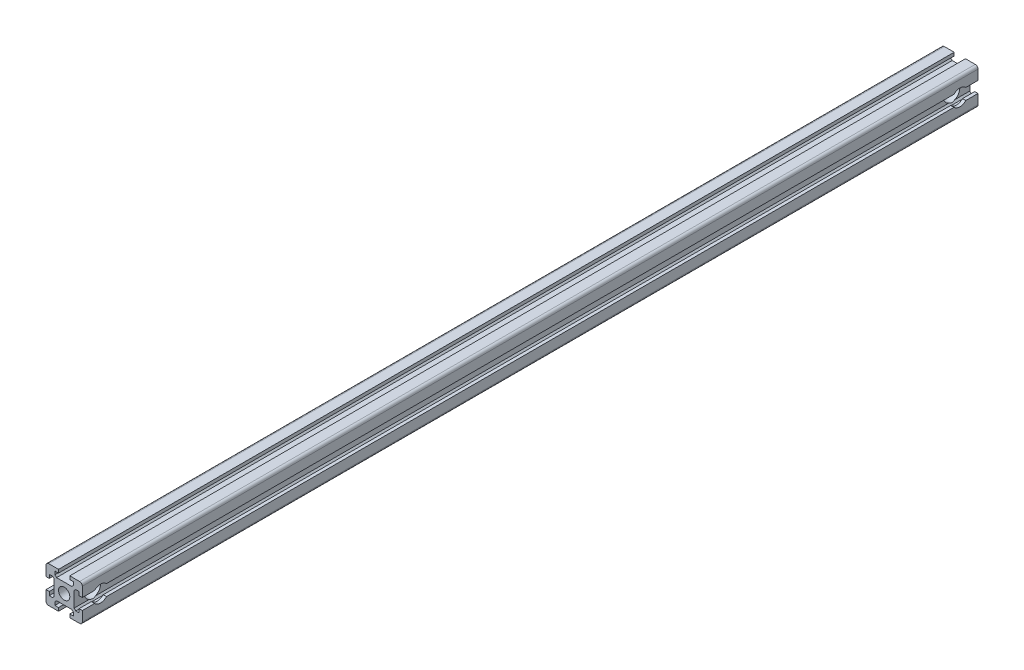
from build123d import *

# Parameters (mm, degrees)
SKETCH1_R               = 3.1
BOSS_EXTRUDE1_DEPTH     = 493
CUT_EXTRUDE2_DEPTH      = 494.34473719
CUT_EXTRUDE2_DEPTH_BACK = 11
SKETCH3_R               = 4.5


with BuildPart() as part:
    # Sketch1 → Boss-Extrude1 (new body)
    with BuildSketch(Plane.XY):
        with BuildLine():
            Line((-10, 3.1), (-8.2, 3.1))
            Line((-8.2, 3.1), (-8.2, 5.1))
            Line((-8.2, 5.1), (-6.4, 5.1))
            Line((-6.4, 5.1), (-5.492892349, 4.192892349))
            Line((-5.492892349, 4.192892349), (-5.492892349, -4.192892349))
            Line((-5.492892349, -4.192892349), (-6.4, -5.1))
            Line((-6.4, -5.1), (-8.2, -5.1))
            Line((-8.2, -5.1), (-8.2, -3.1))
            Line((-8.2, -3.1), (-10, -3.1))
            Line((-10, -3.1), (-10, -8.5))
            ThreePointArc((-10, -8.5), (-9.560660172, -9.560660172), (-8.5, -10))
            Line((-8.5, -10), (-3.1, -10))
            Line((-3.1, -10), (-3.1, -8.2))
            Line((-3.1, -8.2), (-5.1, -8.2))
            Line((-5.1, -8.2), (-5.1, -6.4))
            Line((-5.1, -6.4), (-4.192892349, -5.492892349))
            Line((-4.192892349, -5.492892349), (4.192892349, -5.492892349))
            Line((4.192892349, -5.492892349), (5.1, -6.4))
            Line((5.1, -6.4), (5.1, -8.2))
            Line((5.1, -8.2), (3.1, -8.2))
            Line((3.1, -8.2), (3.1, -10))
            Line((3.1, -10), (8.5, -10))
            ThreePointArc((8.5, -10), (9.560660172, -9.560660172), (10, -8.5))
            Line((10, -8.5), (10, -3.1))
            Line((10, -3.1), (8.2, -3.1))
            Line((8.2, -3.1), (8.2, -5.1))
            Line((8.2, -5.1), (6.4, -5.1))
            Line((6.4, -5.1), (5.492892349, -4.192892349))
            Line((5.492892349, -4.192892349), (5.492892349, 4.192892349))
            Line((5.492892349, 4.192892349), (6.4, 5.1))
            Line((6.4, 5.1), (8.2, 5.1))
            Line((8.2, 5.1), (8.2, 3.1))
            Line((8.2, 3.1), (10, 3.1))
            Line((10, 3.1), (10, 8.5))
            ThreePointArc((10, 8.5), (9.560660172, 9.560660172), (8.5, 10))
            Line((8.5, 10), (3.1, 10))
            Line((3.1, 10), (3.1, 8.2))
            Line((3.1, 8.2), (5.1, 8.2))
            Line((5.1, 8.2), (5.1, 6.4))
            Line((5.1, 6.4), (4.192892349, 5.492892349))
            Line((4.192892349, 5.492892349), (-4.192892349, 5.492892349))
            Line((-4.192892349, 5.492892349), (-5.1, 6.4))
            Line((-5.1, 6.4), (-5.1, 8.2))
            Line((-5.1, 8.2), (-3.1, 8.2))
            Line((-3.1, 8.2), (-3.1, 10))
            Line((-3.1, 10), (-8.5, 10))
            ThreePointArc((-8.5, 10), (-9.560660172, 9.560660172), (-10, 8.5))
            Line((-10, 8.5), (-10, 3.1))
        make_face()
        Circle(SKETCH1_R, mode=Mode.SUBTRACT)
    extrude(amount=BOSS_EXTRUDE1_DEPTH)

    # Sketch3 → Cut-Extrude2 (cut, two sides: drawn at the far end of the back side and taken through both)
    with BuildSketch(Plane(origin=(5.492892349, 0, 0), x_dir=(0, 0, -1), z_dir=(1, 0, 0)).offset(-CUT_EXTRUDE2_DEPTH_BACK)):
        with Locations((-10, 0)):
            Circle(SKETCH3_R)
        with Locations((-483, 0)):
            Circle(SKETCH3_R)
    extrude(amount=CUT_EXTRUDE2_DEPTH + CUT_EXTRUDE2_DEPTH_BACK, mode=Mode.SUBTRACT)


solid = part.part
